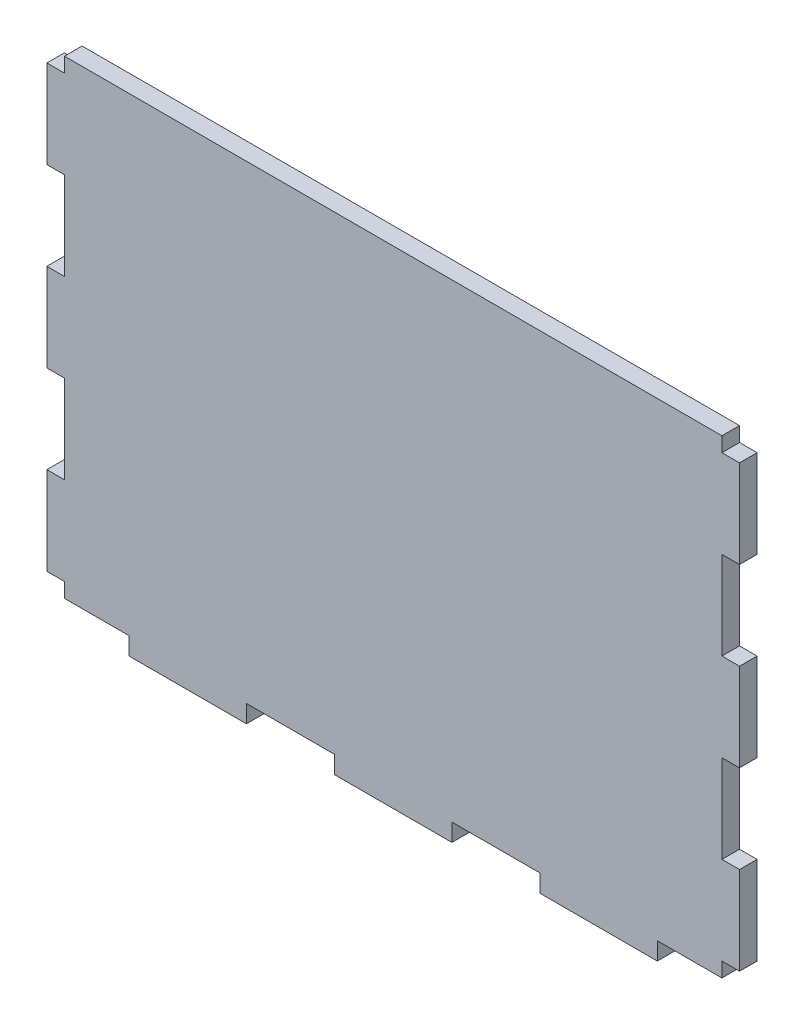
from build123d import *

# Parameters (mm, degrees)
BOSS_EXTRUDE1_DEPTH = 3


with BuildPart() as part:
    # Sketch2 → Boss-Extrude1 (new body)
    with BuildSketch(Plane.XY):
        Polygon((45, -40), (56, -40), (56, -37.5), (59, -37.5), (59, -22.5), (56, -22.5), (56, -7.5), (59, -7.5), (59, 7.5), (56, 7.5), (56, 22.5), (59, 22.5), (59, 37.5), (56, 37.5), (56, 40), (-56, 40), (-56, 37.5), (-59, 37.5), (-59, 22.5), (-56, 22.5), (-56, 7.5), (-59, 7.5), (-59, -7.5), (-56, -7.5), (-56, -22.5), (-59, -22.5), (-59, -37.5), (-56, -37.5), (-56, -40), (-45, -40), (-45, -43), (-25, -43), (-25, -40), (-10, -40), (-10, -43), (10, -43), (10, -40), (25, -40), (25, -43), (45, -43), align=None)
    extrude(amount=BOSS_EXTRUDE1_DEPTH)


solid = part.part
